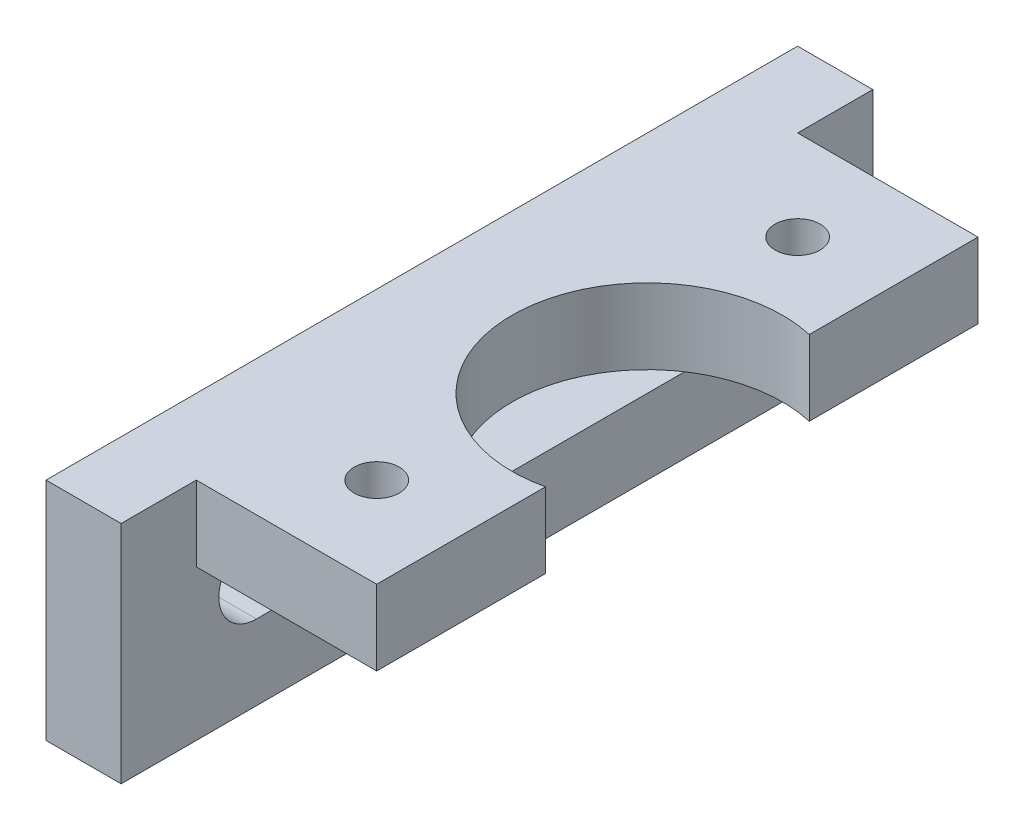
from build123d import *

# Parameters (mm, degrees)
SKETCH_1_W          = 50
SKETCH_1_H          = 15
EXTRUDE_1_DEPTH     = 5
SKETCH_2_W          = 40
SKETCH_2_H          = 5
EXTRUDE_3_DEPTH     = 12
SKETCH_3_R          = 9
SKETCH_3_R_2        = 1.5
CUT_EXTRUDE_1_DEPTH = 32.527765541


with BuildPart() as part:
    # 草图1 → 凸台-拉伸1 (new body)
    with BuildSketch(Plane.ZY):
        Rectangle(SKETCH_1_W, SKETCH_1_H)
        with BuildLine():
            Line((-16, 2.5), (16, 2.5))
            ThreePointArc((16, 2.5), (18.5, 0), (16, -2.5))
            Line((16, -2.5), (-16, -2.5))
            ThreePointArc((-16, -2.5), (-18.5, 0), (-16, 2.5))
        make_face(mode=Mode.SUBTRACT)
    extrude(amount=EXTRUDE_1_DEPTH)

    # 草图2 → 凸台-拉伸3 (add)
    with BuildSketch(Plane(origin=(0, 0, 0), x_dir=(0, 0, -1), z_dir=(1, 0, 0))):
        with Locations((0, 5)):
            Rectangle(SKETCH_2_W, SKETCH_2_H)
    extrude(amount=EXTRUDE_3_DEPTH)

    # 草图3 → 切除-拉伸1 (cut, through all)
    with BuildSketch(Plane(origin=(0, 7.5, 0), x_dir=(1, 0, 0), z_dir=(0, 1, 0))):
        with Locations((10, 0)):
            Circle(SKETCH_3_R)
        with Locations((6, 14)):
            Circle(SKETCH_3_R_2)
        with Locations((6, -14)):
            Circle(SKETCH_3_R_2)
    extrude(amount=-CUT_EXTRUDE_1_DEPTH, mode=Mode.SUBTRACT)


solid = part.part
